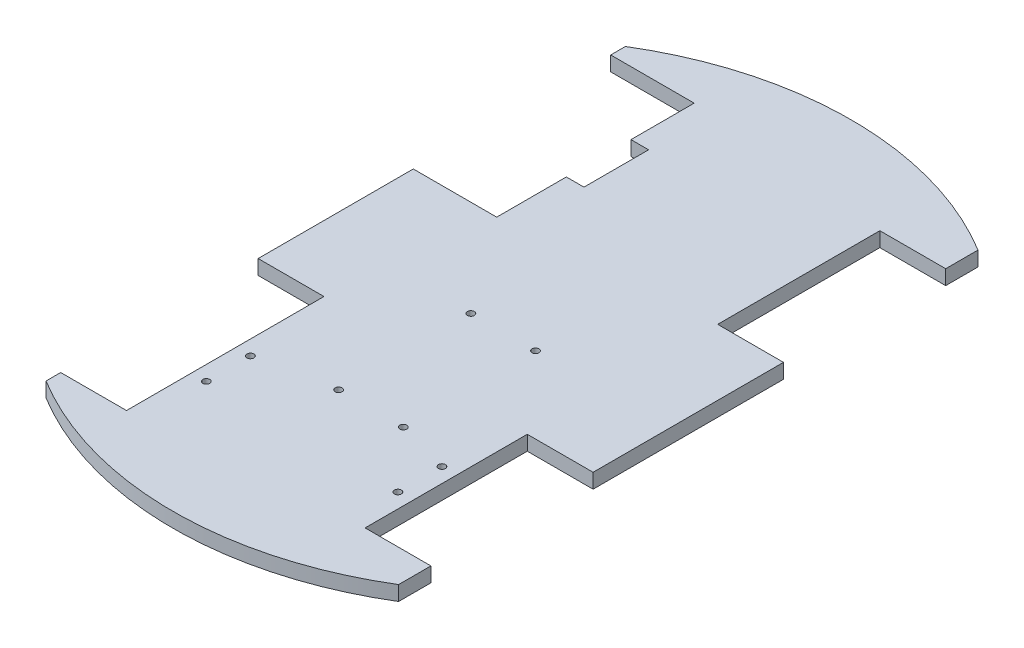
from build123d import *

# Parameters (mm, degrees)
CHASSIS_DEPTH      = 6.35
SKETCH2_R          = 1.5
CUT_EXTRUDE1_DEPTH = 12.7
SKETCH3_R          = 1.5
CUT_EXTRUDE2_DEPTH = 236.541197847


with BuildPart() as part:
    # Sketch1 → Chassis (new body)
    with BuildSketch(Plane(origin=(0, 0, 0), x_dir=(1, 0, 0), z_dir=(0, 1, 0))):
        with BuildLine():
            Line((-40.132, -42.672), (-76.2, -42.672))
            Line((-76.2, -42.672), (-76.2, -109.728))
            Line((-76.2, -109.728), (-47.752, -109.728))
            Line((-47.752, -109.728), (-47.752, -195.072))
            Line((-47.752, -195.072), (-76.2, -195.072))
            Line((-76.2, -195.072), (-76.2, -201.422))
            ThreePointArc((-76.2, -201.422), (0, -222.784410099), (76.2, -201.422))
            Line((76.2, -201.422), (76.2, -187.452))
            Line((76.2, -187.452), (47.752, -187.452))
            Line((47.752, -187.452), (47.752, -117.348))
            Line((47.752, -117.348), (76.2, -117.348))
            Line((76.2, -117.348), (76.2, -35.052))
            Line((76.2, -35.052), (47.752, -35.052))
            Line((47.752, -35.052), (47.752, 35.052))
            Line((47.752, 35.052), (76.2, 35.052))
            Line((76.2, 35.052), (76.2, 49.022))
            ThreePointArc((76.2, 49.022), (0, 70.384410099), (-76.2, 49.022))
            Line((-76.2, 49.022), (-76.2, 42.672))
            Line((-76.2, 42.672), (-40.132, 42.672))
            Line((-40.132, 42.672), (-40.132, 15.353478138))
            Line((-40.132, 15.353478138), (-32.512, 15.353478138))
            Line((-32.512, 15.353478138), (-32.512, -12.586521862))
            Line((-32.512, -12.586521862), (-40.132, -12.586521862))
            Line((-40.132, -12.586521862), (-40.132, -42.672))
        make_face()
    extrude(amount=CHASSIS_DEPTH)

    # Sketch2 → Cut-Extrude1 (cut)
    with BuildSketch(Plane(origin=(0, 6.35, 0), x_dir=(1, 0, 0), z_dir=(0, 1, 0))):
        with Locations((18.288, -84.328)):
            Circle(SKETCH2_R)
        with Locations((-9.652, -84.328)):
            Circle(SKETCH2_R)
        with Locations((-9.652, -141.478)):
            Circle(SKETCH2_R)
        with Locations((18.288, -141.478)):
            Circle(SKETCH2_R)
    extrude(amount=-CUT_EXTRUDE1_DEPTH, mode=Mode.SUBTRACT)

    # Sketch3 → Cut-Extrude2 (cut, through all)
    with BuildSketch(Plane(origin=(0, 6.35, 0), x_dir=(1, 0, 0), z_dir=(0, 1, 0))):
        with Locations((-41.402, -147.875000023)):
            Circle(SKETCH3_R)
        with Locations((-41.402, -166.925000023)):
            Circle(SKETCH3_R)
        with Locations((41.402, -166.924999977)):
            Circle(SKETCH3_R)
        with Locations((41.402, -147.874999977)):
            Circle(SKETCH3_R)
    extrude(amount=-CUT_EXTRUDE2_DEPTH, mode=Mode.SUBTRACT)


solid = part.part
